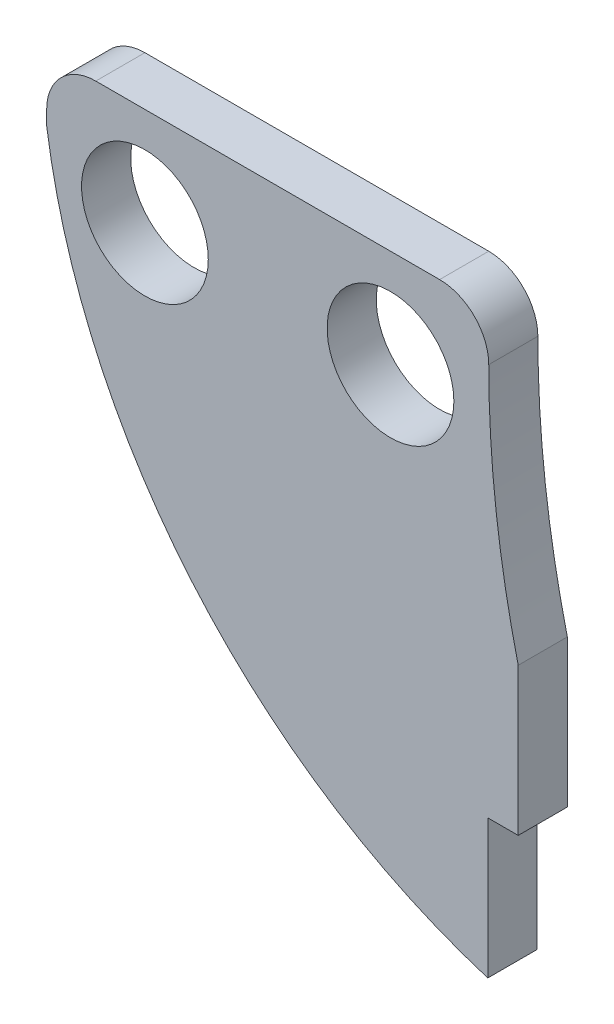
from build123d import *

# Parameters (mm, degrees)
SKETCH2_R           = 6.45
BOSS_EXTRUDE1_DEPTH = 5
CUT_EXTRUDE1_START  = -57.18341
SKETCH3_W           = 3.1
SKETCH3_H           = 5
CUT_EXTRUDE1_DEPTH  = 15
FILLET1_R           = 5


with BuildPart() as part:
    # Sketch2 → Boss-Extrude1 (new body)
    with BuildSketch(Plane.XY):
        with BuildLine():
            Line((22.650655022, -27.183406114), (22.650655022, -57.183406114))
            ThreePointArc((22.650655022, -57.183406114), (-9.462495777, -37.680698146), (-25.349344978, -3.633406114))
            Line((-25.349344978, -3.633406114), (-25.349344978, 2.816593886))
            Line((-25.349344978, 2.816593886), (19.650655022, 2.816593886))
            Line((19.650655022, 2.816593886), (19.650655022, -2.183406114))
            ThreePointArc((19.650655022, -2.183406114), (20.403335755, -14.773084426), (22.650655022, -27.183406114))
        make_face()
        with Locations((9.650655022, -7.183406114)):
            Circle(SKETCH2_R, mode=Mode.SUBTRACT)
        with Locations((-15.349344978, -7.183406114)):
            Circle(SKETCH2_R, mode=Mode.SUBTRACT)
    extrude(amount=BOSS_EXTRUDE1_DEPTH)

    # Sketch3 → Cut-Extrude1 (cut)
    with BuildSketch(Plane(origin=(0, 0, 0), x_dir=(1, 0, 0), z_dir=(0, 1, 0)).offset(CUT_EXTRUDE1_START)):
        with Locations((21.100655022, -2.5)):
            Rectangle(SKETCH3_W, SKETCH3_H)
    extrude(amount=CUT_EXTRUDE1_DEPTH, mode=Mode.SUBTRACT)

    # Fillet1
    fillet1_edges = [part.edges().sort_by_distance(p)[0] for p in [
        (-25.349344978, 2.816593886, 2.5),
        (19.650655022, 2.816593886, 2.5),
    ]]
    fillet(fillet1_edges, radius=FILLET1_R - 0.0001)  # a hair under: the kernel refuses the full size


solid = part.part
